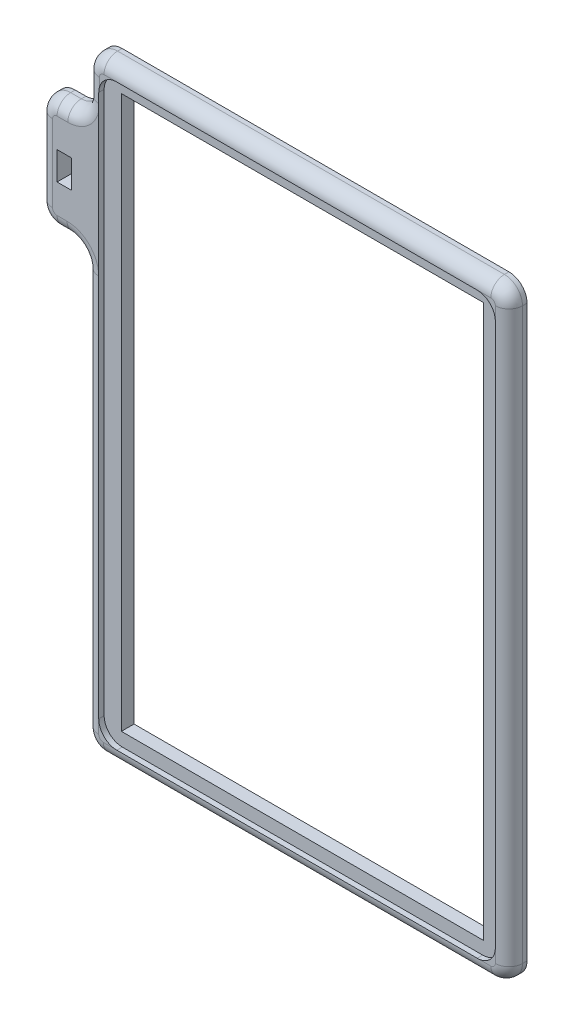
from build123d import *

# Parameters (mm, degrees)
SCHIZZO1_W                   = 3.2
SCHIZZO1_H                   = 6.2
SCHIZZO1_W_2                 = 80
SCHIZZO1_H_2                 = 122
ESTRUSIONE_ESTRUSIONE1_DEPTH = 4
SCHIZZO5_W                   = 80
SCHIZZO5_H                   = 122
TAGLIO_ESTRUSIONE4_DEPTH     = 1.2
SCHIZZO6_R                   = 0.75
TAGLIO_ESTRUSIONE5_DEPTH     = 3
RACCORDO1_R                  = 3


with BuildPart() as part:
    # Schizzo1 → Estrusione-Estrusione1 (new body)
    with BuildSketch(Plane.XY):
        with BuildLine():
            Line((-42.8, -66.9), (42.8, -66.9))
            ThreePointArc((42.8, -66.9), (45.628427125, -65.728427125), (46.8, -62.9))
            Line((46.8, -62.9), (46.8, 62.9))
            ThreePointArc((46.8, 62.9), (45.628427125, 65.728427125), (42.8, 66.9))
            Line((42.8, 66.9), (-42.638118868, 66.9))
            ThreePointArc((-42.638118868, 66.9), (-45.466545993, 65.728427125), (-46.638118868, 62.9))
            Line((-46.638118868, 62.9), (-46.638118868, 57.77646377))
            ThreePointArc((-46.638118868, 57.77646377), (-47.809691743, 54.948036646), (-50.638118868, 53.77646377))
            Line((-50.638118868, 53.77646377), (-53, 53.77646377))
            ThreePointArc((-53, 53.77646377), (-55.828427125, 52.604890895), (-57, 49.77646377))
            Line((-57, 49.77646377), (-57, 32.77646377))
            ThreePointArc((-57, 32.77646377), (-55.828427125, 29.948036646), (-53, 28.77646377))
            Line((-53, 28.77646377), (-50.8, 28.77646377))
            ThreePointArc((-50.8, 28.77646377), (-47.971572875, 27.604890895), (-46.8, 24.77646377))
            Line((-46.8, 24.77646377), (-46.8, -62.9))
            ThreePointArc((-46.8, -62.9), (-45.628427125, -65.728427125), (-42.8, -66.9))
        make_face()
        with Locations((-51.4, 41.27646377)):
            Rectangle(SCHIZZO1_W, SCHIZZO1_H, mode=Mode.SUBTRACT)
        Rectangle(SCHIZZO1_W_2, SCHIZZO1_H_2, mode=Mode.SUBTRACT)
    extrude(amount=ESTRUSIONE_ESTRUSIONE1_DEPTH)

    # Schizzo5 → Taglio-Estrusione4 (cut)
    with BuildSketch(Plane.XY.offset(4)):
        with BuildLine():
            Line((-39.8, 63.9), (39.8, 63.9))
            ThreePointArc((39.8, 63.9), (42.628427125, 62.728427125), (43.8, 59.9))
            Line((43.8, 59.9), (43.8, -59.9))
            ThreePointArc((43.8, -59.9), (42.628427125, -62.728427125), (39.8, -63.9))
            Line((39.8, -63.9), (-39.8, -63.9))
            ThreePointArc((-39.8, -63.9), (-42.628427125, -62.728427125), (-43.8, -59.9))
            Line((-43.8, -59.9), (-43.8, 59.9))
            ThreePointArc((-43.8, 59.9), (-42.628427125, 62.728427125), (-39.8, 63.9))
        make_face()
        Rectangle(SCHIZZO5_W, SCHIZZO5_H, mode=Mode.SUBTRACT)
    extrude(amount=-TAGLIO_ESTRUSIONE4_DEPTH, mode=Mode.SUBTRACT)

    # Schizzo6 → Taglio-Estrusione5 (cut)
    with BuildSketch(Plane(origin=(0, 0, 0), x_dir=(-1, 0, 0), z_dir=(0, 0, -1))):
        with Locations((51.344911825, 48.77646377)):
            Circle(SCHIZZO6_R)
        with Locations((51.344911825, 33.77646377)):
            Circle(SCHIZZO6_R)
    extrude(amount=-TAGLIO_ESTRUSIONE5_DEPTH, mode=Mode.SUBTRACT)

    # Raccordo1
    # the kernel refuses this fillet: 3 mm, written as the material it takes off along each edge
    with BuildSketch(Plane(origin=(-42.8, -66.9, 4), x_dir=(0, 0, -1), z_dir=(1, 0, 0))) as raccordo1_piece_1:
        with BuildLine():
            CenterArc((RACCORDO1_R, RACCORDO1_R), RACCORDO1_R, 180, 90)
            Line((0, RACCORDO1_R), (0, 0))
            Line((0, 0), (RACCORDO1_R, 0))
        make_face()
    extrude(amount=85.6, mode=Mode.SUBTRACT)
    with BuildSketch(Plane(origin=(42.8, -62.9, 4), x_dir=(0, -1, 0), z_dir=(-1, 0, 0))) as raccordo1_piece_2:
        with BuildLine():
            CenterArc((4 - RACCORDO1_R, -RACCORDO1_R), RACCORDO1_R, 0, 90)
            Line((4 - RACCORDO1_R, 0), (4, 0))
            Line((4, 0), (4, -RACCORDO1_R))
        make_face()
    revolve(axis=Axis((42.8, -62.9, 4), (0, 0, 1)), revolution_arc=90, mode=Mode.SUBTRACT)
    with BuildSketch(Plane(origin=(46.8, -62.9, 4), x_dir=(-1, 0, 0), z_dir=(0, 1, 0))) as raccordo1_piece_3:
        with BuildLine():
            CenterArc((RACCORDO1_R, -RACCORDO1_R), RACCORDO1_R, 90, 90)
            Line((0, -RACCORDO1_R), (0, 0))
            Line((0, 0), (RACCORDO1_R, 0))
        make_face()
    extrude(amount=125.8, mode=Mode.SUBTRACT)
    with BuildSketch(Plane(origin=(42.8, 62.9, 4), x_dir=(1, 0, 0), z_dir=(0, -1, 0))) as raccordo1_piece_4:
        with BuildLine():
            CenterArc((4 - RACCORDO1_R, -RACCORDO1_R), RACCORDO1_R, 0, 90)
            Line((4, -RACCORDO1_R), (4, 0))
            Line((4, 0), (4 - RACCORDO1_R, 0))
        make_face()
    revolve(axis=Axis((42.8, 62.9, 4), (0, 0, 1)), revolution_arc=90, mode=Mode.SUBTRACT)
    with BuildSketch(Plane(origin=(42.8, 66.9, 4), x_dir=(0, -1, 0), z_dir=(-1, 0, 0))) as raccordo1_piece_5:
        with BuildLine():
            CenterArc((RACCORDO1_R, -RACCORDO1_R), RACCORDO1_R, 90, 90)
            Line((0, -RACCORDO1_R), (0, 0))
            Line((0, 0), (RACCORDO1_R, 0))
        make_face()
    extrude(amount=85.438118868, mode=Mode.SUBTRACT)
    with BuildSketch(Plane(origin=(-42.638118868, 62.9, 4), x_dir=(0, 1, 0), z_dir=(1, 0, 0))) as raccordo1_piece_6:
        with BuildLine():
            CenterArc((4 - RACCORDO1_R, -RACCORDO1_R), RACCORDO1_R, 0, 90)
            Line((4, -RACCORDO1_R), (4, 0))
            Line((4, 0), (4 - RACCORDO1_R, 0))
        make_face()
    revolve(axis=Axis((-42.638118868, 62.9, 4), (0, 0, 1)), revolution_arc=90, mode=Mode.SUBTRACT)
    with BuildSketch(Plane(origin=(-46.638118868, 62.9, 4), x_dir=(1, 0, 0), z_dir=(0, -1, 0))) as raccordo1_piece_7:
        with BuildLine():
            CenterArc((RACCORDO1_R, -RACCORDO1_R), RACCORDO1_R, 90, 90)
            Line((0, -RACCORDO1_R), (0, 0))
            Line((0, 0), (RACCORDO1_R, 0))
        make_face()
    extrude(amount=5.12353623, mode=Mode.SUBTRACT)
    with BuildSketch(Plane(origin=(-50.638118868, 57.77646377, 4), x_dir=(1, 0, 0), z_dir=(0, 1, 0))) as raccordo1_piece_8:
        with BuildLine():
            CenterArc((4 + RACCORDO1_R, RACCORDO1_R), RACCORDO1_R, 180, 90)
            Line((4, RACCORDO1_R), (4, 0))
            Line((4, 0), (4 + RACCORDO1_R, 0))
        make_face()
    revolve(axis=Axis((-50.638118868, 57.77646377, 4), (0, 0, -1)), revolution_arc=90, mode=Mode.SUBTRACT)
    with BuildSketch(Plane(origin=(-50.638118868, 53.77646377, 4), x_dir=(0, -1, 0), z_dir=(-1, 0, 0))) as raccordo1_piece_9:
        with BuildLine():
            CenterArc((RACCORDO1_R, -RACCORDO1_R), RACCORDO1_R, 90, 90)
            Line((0, -RACCORDO1_R), (0, 0))
            Line((0, 0), (RACCORDO1_R, 0))
        make_face()
    extrude(amount=2.361881132, mode=Mode.SUBTRACT)
    with BuildSketch(Plane(origin=(-53, 49.77646377, 4), x_dir=(0, 1, 0), z_dir=(1, 0, 0))) as raccordo1_piece_10:
        with BuildLine():
            CenterArc((4 - RACCORDO1_R, -RACCORDO1_R), RACCORDO1_R, 0, 90)
            Line((4, -RACCORDO1_R), (4, 0))
            Line((4, 0), (4 - RACCORDO1_R, 0))
        make_face()
    revolve(axis=Axis((-53, 49.77646377, 4), (0, 0, 1)), revolution_arc=90, mode=Mode.SUBTRACT)
    with BuildSketch(Plane(origin=(-57, 49.77646377, 4), x_dir=(1, 0, 0), z_dir=(0, -1, 0))) as raccordo1_piece_11:
        with BuildLine():
            CenterArc((RACCORDO1_R, -RACCORDO1_R), RACCORDO1_R, 90, 90)
            Line((0, -RACCORDO1_R), (0, 0))
            Line((0, 0), (RACCORDO1_R, 0))
        make_face()
    extrude(amount=17, mode=Mode.SUBTRACT)
    with BuildSketch(Plane(origin=(-53, 32.77646377, 4), x_dir=(-1, 0, 0), z_dir=(0, 1, 0))) as raccordo1_piece_12:
        with BuildLine():
            CenterArc((4 - RACCORDO1_R, -RACCORDO1_R), RACCORDO1_R, 0, 90)
            Line((4, -RACCORDO1_R), (4, 0))
            Line((4, 0), (4 - RACCORDO1_R, 0))
        make_face()
    revolve(axis=Axis((-53, 32.77646377, 4), (0, 0, 1)), revolution_arc=90, mode=Mode.SUBTRACT)
    with BuildSketch(Plane(origin=(-53, 28.77646377, 4), x_dir=(0, 1, 0), z_dir=(1, 0, 0))) as raccordo1_piece_13:
        with BuildLine():
            CenterArc((RACCORDO1_R, -RACCORDO1_R), RACCORDO1_R, 90, 90)
            Line((0, -RACCORDO1_R), (0, 0))
            Line((0, 0), (RACCORDO1_R, 0))
        make_face()
    extrude(amount=2.2, mode=Mode.SUBTRACT)
    with BuildSketch(Plane(origin=(-50.8, 24.77646377, 4), x_dir=(0, 1, 0), z_dir=(-1, 0, 0))) as raccordo1_piece_14:
        with BuildLine():
            CenterArc((4 + RACCORDO1_R, RACCORDO1_R), RACCORDO1_R, 180, 90)
            Line((4, RACCORDO1_R), (4, 0))
            Line((4, 0), (4 + RACCORDO1_R, 0))
        make_face()
    revolve(axis=Axis((-50.8, 24.77646377, 4), (0, 0, -1)), revolution_arc=90, mode=Mode.SUBTRACT)
    with BuildSketch(Plane(origin=(-46.8, 24.77646377, 4), x_dir=(1, 0, 0), z_dir=(0, -1, 0))) as raccordo1_piece_15:
        with BuildLine():
            CenterArc((RACCORDO1_R, -RACCORDO1_R), RACCORDO1_R, 90, 90)
            Line((0, -RACCORDO1_R), (0, 0))
            Line((0, 0), (RACCORDO1_R, 0))
        make_face()
    extrude(amount=87.67646377, mode=Mode.SUBTRACT)
    with BuildSketch(Plane(origin=(-42.8, -62.9, 4), x_dir=(-1, 0, 0), z_dir=(0, 1, 0))) as raccordo1_piece_16:
        with BuildLine():
            CenterArc((4 - RACCORDO1_R, -RACCORDO1_R), RACCORDO1_R, 0, 90)
            Line((4 - RACCORDO1_R, 0), (4, 0))
            Line((4, 0), (4, -RACCORDO1_R))
        make_face()
    revolve(axis=Axis((-42.8, -62.9, 4), (0, 0, 1)), revolution_arc=90, mode=Mode.SUBTRACT)


solid = part.part
